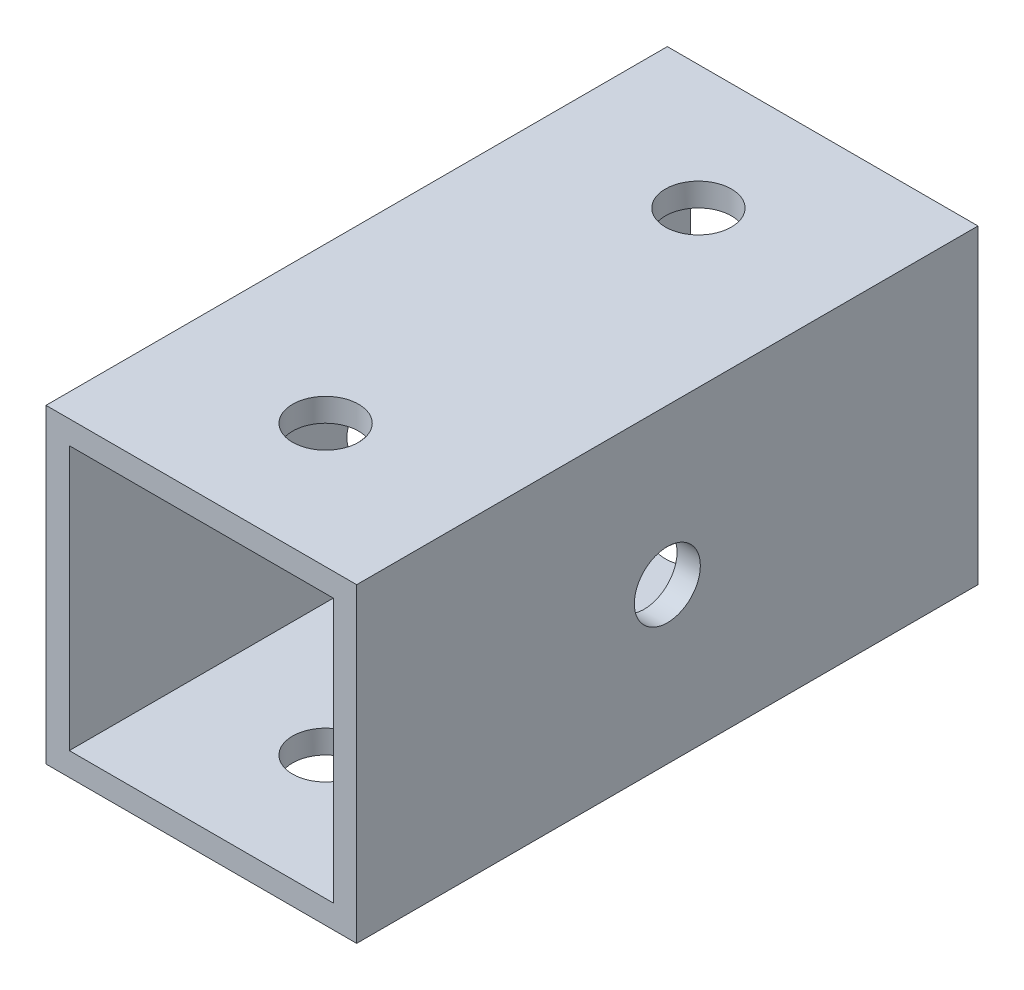
from build123d import *

# Parameters (mm, degrees)
SKETCH1_W           = 20
SKETCH1_H           = 20
SKETCH1_W_2         = 17
SKETCH1_H_2         = 17
BOSS_EXTRUDE1_DEPTH = 40
SKETCH2_R           = 2.125
CUT_EXTRUDE1_DEPTH  = 46.82575695
SKETCH3_R           = 2.125
CUT_EXTRUDE2_DEPTH  = 46.82575695


with BuildPart() as part:
    # Sketch1 → Boss-Extrude1 (new body)
    with BuildSketch(Plane.XY):
        Rectangle(SKETCH1_W, SKETCH1_H)
        Rectangle(SKETCH1_W_2, SKETCH1_H_2, mode=Mode.SUBTRACT)
    extrude(amount=-BOSS_EXTRUDE1_DEPTH)

    # Sketch2 → Cut-Extrude1 (cut, through all)
    with BuildSketch(Plane(origin=(0, 10, 0), x_dir=(1, 0, 0), z_dir=(0, 1, 0))):
        with Locations((0, 8)):
            Circle(SKETCH2_R)
        with Locations((0, 32)):
            Circle(SKETCH2_R)
    extrude(amount=-CUT_EXTRUDE1_DEPTH, mode=Mode.SUBTRACT)

    # Sketch3 → Cut-Extrude2 (cut, through all)
    with BuildSketch(Plane(origin=(10, 0, 0), x_dir=(0, 0, -1), z_dir=(1, 0, 0))):
        with Locations((20, 0)):
            Circle(SKETCH3_R)
    extrude(amount=-CUT_EXTRUDE2_DEPTH, mode=Mode.SUBTRACT)


solid = part.part
